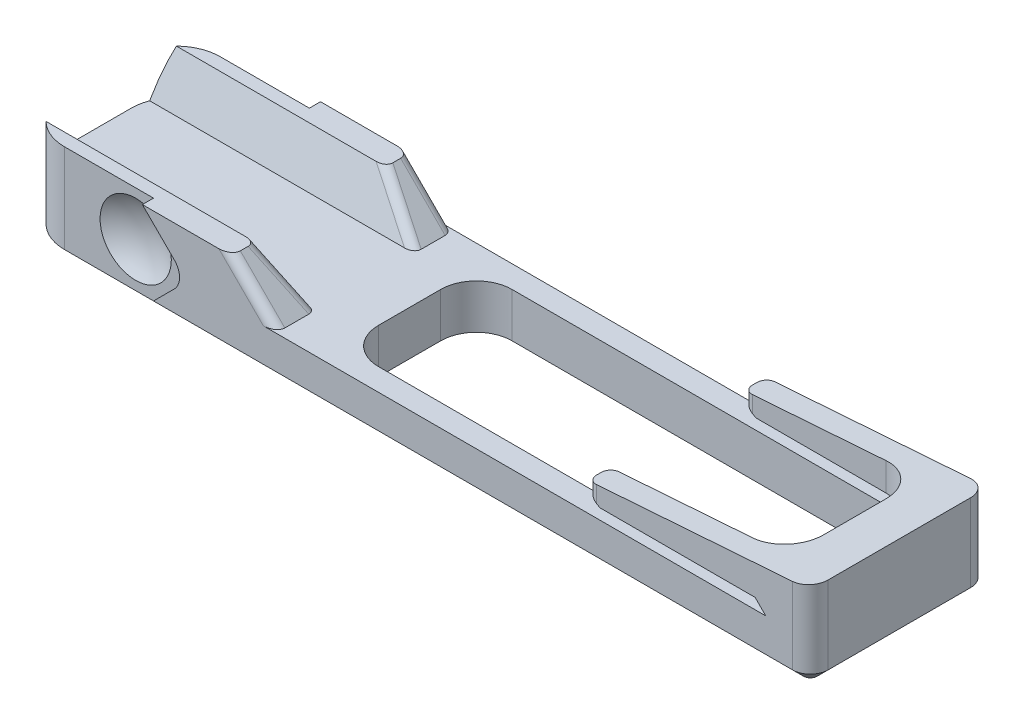
from build123d import *

# Parameters (mm, degrees)
BOSS_EXTRUDE1_DEPTH = 12.7
SKETCH2_W           = 19.05
SKETCH2_H           = 6.35
CUT_EXTRUDE1_DEPTH  = 107.95
CUT_EXTRUDE2_DEPTH  = 64.816710194
CHAMFER1_SIZE       = 6.978592645
CHAMFER1_SIZE_2     = 2.54
CUT_EXTRUDE3_DEPTH  = 1.5875
CHAMFER3_SIZE       = 1.5875
FILLET1_R           = 6.35
FILLET2_R           = 1.27
FILLET3_R           = 5.08
CHAMFER4_SIZE       = 1.524
CUT_EXTRUDE4_DEPTH  = 59.887477446


# Some blends are built 0.0001 mm under size
with BuildPart() as part:
    # Sketch1 → Boss-Extrude1 (new body)
    with BuildSketch(Plane(origin=(0, 0, 0), x_dir=(1, 0, 0), z_dir=(0, 1, 0))):
        with BuildLine():
            Line((-50.8, 12.7), (-57.15, 12.7))
            Line((-57.15, 12.7), (-57.15, 6.35))
            Line((-57.15, 6.35), (-57.15, -6.35))
            Line((-57.15, -6.35), (-57.15, -12.7))
            Line((-57.15, -12.7), (-50.8, -12.7))
            Line((-50.8, -12.7), (54.61, -12.7))
            ThreePointArc((54.61, -12.7), (56.406051224, -11.956051224), (57.15, -10.16))
            Line((57.15, -10.16), (57.15, 10.16))
            ThreePointArc((57.15, 10.16), (56.406051224, 11.956051224), (54.61, 12.7))
            Line((54.61, 12.7), (-50.8, 12.7))
        make_face()
    extrude(amount=BOSS_EXTRUDE1_DEPTH)

    # Sketch2 → Cut-Extrude1 (cut)
    with BuildSketch(Plane.ZY.offset(57.15)):
        with Locations((0, 9.525)):
            Rectangle(SKETCH2_W, SKETCH2_H)
    extrude(amount=-CUT_EXTRUDE1_DEPTH, mode=Mode.SUBTRACT)

    # Sketch3 → Cut-Extrude2 (cut, through all)
    with BuildSketch(Plane.XY.offset(12.7)):
        Polygon((25.4, 10.414), (57.15, 12.7), (-25.4, 12.7), (-19.05, 6.35), (50.8, 6.35), (50.8, 7.874), (27.15976362, 7.874), (25.4, 8.89), align=None)
    extrude(amount=-CUT_EXTRUDE2_DEPTH, mode=Mode.SUBTRACT)

    # Chamfer1
    # the kernel refuses this chamfer: 6.978592645, 2.54 mm, written as the material it adds along each edge
    with BuildSketch(Plane(origin=(-57.15, 6.35, 9.525), x_dir=(0, 0.9999130865277316, 0.013184058198642549), z_dir=(1, 0, 0))) as chamfer1_piece_1_section:
        Polygon((CHAMFER1_SIZE * 0.999913086587, -CHAMFER1_SIZE * 0.0131840581994), (-CHAMFER1_SIZE_2 * 0.0131840581987, -CHAMFER1_SIZE_2 * 0.999913086528), (0, 0), align=None)
    chamfer1_piece_1 = extrude(amount=56.203828281, mode=Mode.PRIVATE)
    chamfer1_piece_1 = split(chamfer1_piece_1, bisect_by=Plane(origin=(-39.199121236, 12.7, 8.706690515), z_dir=(0, -1, 0)), keep=Keep.TOP, mode=Mode.PRIVATE)
    chamfer1_piece_1 = split(chamfer1_piece_1, bisect_by=Plane(origin=(-30.223681853, 17.523681853, 8.706690515), z_dir=(-0.7071067811865448, -0.7071067811865503, 0)), keep=Keep.TOP, mode=Mode.PRIVATE)
    add(chamfer1_piece_1)
    with BuildSketch(Plane(origin=(-57.15, 6.35, -9.525), x_dir=(0, -0.09904090225207035, 0.9950833631817466), z_dir=(1, 0, 0))) as chamfer1_piece_2_section:
        Polygon((CHAMFER1_SIZE_2 * 0.995083363182, -CHAMFER1_SIZE_2 * 0.099040902252), (-CHAMFER1_SIZE * 0.099040902258, -CHAMFER1_SIZE * 0.995083363241), (0, 0), align=None)
    chamfer1_piece_2 = extrude(amount=56.203828281, mode=Mode.PRIVATE)
    chamfer1_piece_2 = split(chamfer1_piece_2, bisect_by=Plane(origin=(-30.223681853, 17.523681853, -8.706690515), z_dir=(-0.7071067811865448, -0.7071067811865503, 0)), keep=Keep.TOP, mode=Mode.PRIVATE)
    chamfer1_piece_2 = split(chamfer1_piece_2, bisect_by=Plane(origin=(-39.199121236, 12.7, -8.706690515), z_dir=(0, -1, 0)), keep=Keep.TOP, mode=Mode.PRIVATE)
    add(chamfer1_piece_2)

    # Sketch4 → Cut-Extrude3 (cut)
    with BuildSketch(Plane.XY.offset(12.7)):
        with BuildLine():
            Line((-57.15, 12.7), (-57.15, 0))
            Line((-57.15, 0), (-38.1, 0))
            Line((-38.1, 0), (-33.546051224, 4.553948776))
            ThreePointArc((-33.546051224, 4.553948776), (-32.802102448, 6.35), (-33.546051224, 8.146051224))
            Line((-33.546051224, 8.146051224), (-38.1, 12.7))
            Line((-38.1, 12.7), (-57.15, 12.7))
        make_face()
    cut_extrude3 = extrude(amount=-CUT_EXTRUDE3_DEPTH, mode=Mode.SUBTRACT)

    # Sketch6 → Cut-Revolve1 (revolve, cut)
    with BuildSketch(Plane.ZY.offset(40.64)):
        with BuildLine():
            Line((11.1125, 6.35), (11.1125, 11.43))
            ThreePointArc((11.1125, 11.43), (9.931118256, 9.01113492), (9.525, 6.35))
            Line((9.525, 6.35), (11.1125, 6.35))
        make_face()
    cut_revolve1 = revolve(axis=Axis((-40.64, 6.35, 12.7), (0, 0, -1)), mode=Mode.SUBTRACT)

    # Mirror1: Cut-Extrude3, Cut-Revolve1 across plane
    add(cut_extrude3.mirror(Plane(origin=(0, 0, 0), x_dir=(1, 0, 0), z_dir=(0, 0, -1))), mode=Mode.SUBTRACT)
    add(cut_revolve1.mirror(Plane(origin=(0, 0, 0), x_dir=(1, 0, 0), z_dir=(0, 0, -1))), mode=Mode.SUBTRACT)

    # Chamfer3
    chamfer3_edges = [part.edges().sort_by_distance(p)[0] for p in [
        (8.255, 0, 12.7),
        (56.406051224, 0, 11.956051224),
        (57.15, 0, 0),
        (56.406051224, 0, -11.956051224),
        (8.255, 0, -12.7),
    ]]
    chamfer(chamfer3_edges, length=CHAMFER3_SIZE)

    # Fillet1
    fillet1_edges = [part.edges().sort_by_distance(p)[0] for p in [
        (-57.15, 6.35, -11.1125),
        (-57.15, 6.35, 11.1125),
    ]]
    fillet(fillet1_edges, radius=FILLET1_R)

    # Fillet2
    fillet2_edges = [part.edges().sort_by_distance(p)[0] for p in [
        (-22.225, 9.525, 8.140605494),
        (-22.225, 9.525, -8.140605494),
        (25.4, 9.652, -9.525),
        (-22.225, 9.525, 12.7),
        (25.4, 9.652, 12.7),
        (25.4, 9.652, 9.525),
        (25.4, 9.652, -12.7),
        (-22.225, 9.525, -12.7),
    ]]
    fillet(fillet2_edges, radius=FILLET2_R)

    # Fillet3
    fillet3_edges = [part.edges().sort_by_distance(p)[0] for p in [
        (50.8, 10.0584, -9.525),
        (50.8, 10.0584, 9.525),
    ]]
    fillet(fillet3_edges, radius=FILLET3_R)

    # Chamfer4
    chamfer4_edges = [part.edges().sort_by_distance(p)[0] for p in [
        (50.8, 7.874, -8.5725),
        (50.8, 7.874, 8.5725),
    ]]
    chamfer(chamfer4_edges, length=CHAMFER4_SIZE - 0.0001)  # a hair under: the kernel refuses the full size

    # Sketch7 → Cut-Extrude4 (cut, through all)
    with BuildSketch(Plane(origin=(0, 6.35, 0), x_dir=(1, 0, 0), z_dir=(0, 1, 0))):
        with BuildLine():
            Line((26.67, -9.525), (45.72, -9.525))
            ThreePointArc((45.72, -9.525), (49.312102448, -8.037102448), (50.8, -4.445))
            Line((50.8, -4.445), (50.8, 4.445))
            ThreePointArc((50.8, 4.445), (49.312102448, 8.037102448), (45.72, 9.525))
            Line((45.72, 9.525), (26.67, 9.525))
            Line((26.67, 9.525), (-7.62, 9.525))
            ThreePointArc((-7.62, 9.525), (-11.212102448, 8.037102448), (-12.7, 4.445))
            Line((-12.7, 4.445), (-12.7, -4.445))
            ThreePointArc((-12.7, -4.445), (-11.212102448, -8.037102448), (-7.62, -9.525))
            Line((-7.62, -9.525), (26.67, -9.525))
        make_face()
    extrude(amount=-CUT_EXTRUDE4_DEPTH, mode=Mode.SUBTRACT)


solid = part.part
